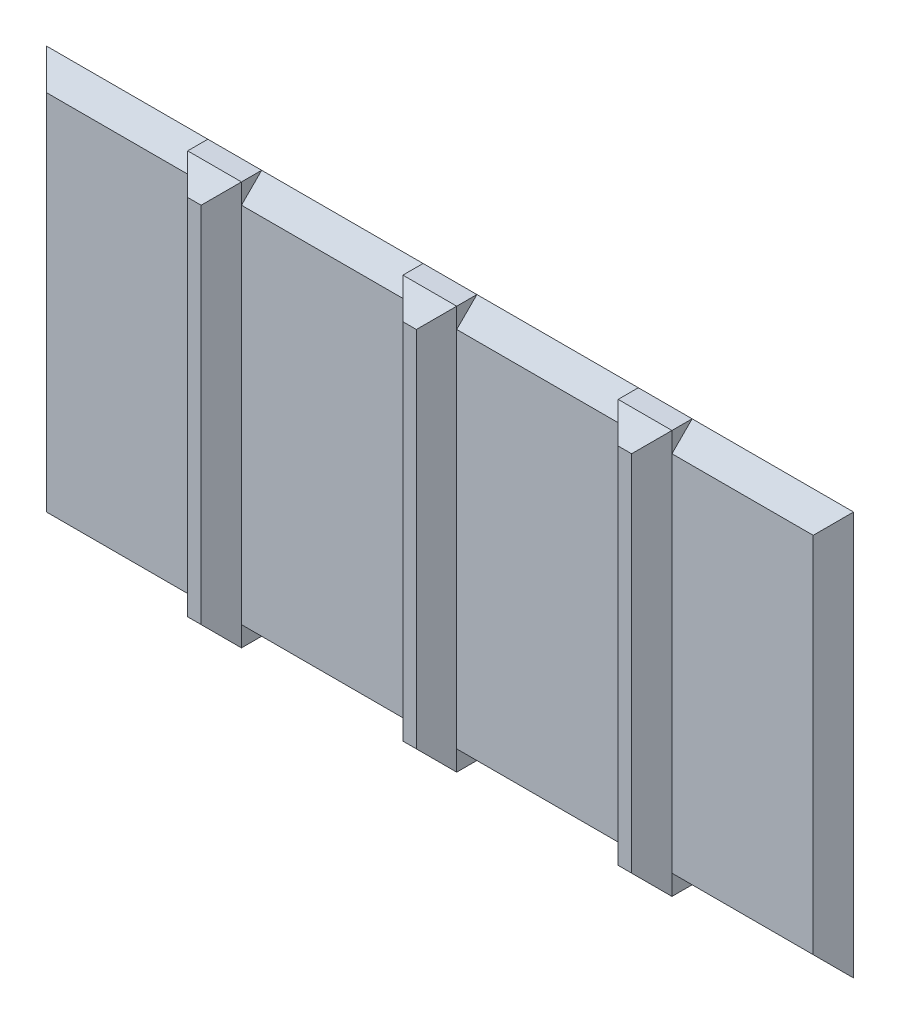
from build123d import *

# Parameters (mm, degrees)
SKETCH1_W           = 10.16
SKETCH1_H           = 5.08
BOSS_EXTRUDE1_DEPTH = 0.508
SKETCH2_W           = 0.6773418
SKETCH2_H           = 5.08
BOSS_EXTRUDE2_DEPTH = 0.254
CHAMFER3_SIZE       = 0.254
CHAMFER4_SIZE       = 0.254
CHAMFER5_SIZE       = 0.254


with BuildPart() as part:
    # Sketch1 → Boss-Extrude1 (new body)
    with BuildSketch(Plane.XY):
        with Locations((5.08, 2.54)):
            Rectangle(SKETCH1_W, SKETCH1_H)
    extrude(amount=BOSS_EXTRUDE1_DEPTH)

    # Sketch2 → Boss-Extrude2 (add)
    with BuildSketch(Plane.XY.offset(0.508)):
        with Locations((2.3706709, 2.54)):
            Rectangle(SKETCH2_W, SKETCH2_H)
        with Locations((5.0800127, 2.54)):
            Rectangle(SKETCH2_W, SKETCH2_H)
        with Locations((7.7893545, 2.54)):
            Rectangle(SKETCH2_W, SKETCH2_H)
    extrude(amount=BOSS_EXTRUDE2_DEPTH)

    # Chamfer3
    chamfer3_edges = [part.edges().sort_by_distance(p)[0] for p in [
        (5.08, 5.08, 0),
        (10.16, 2.54, 0),
        (5.08, 0, 0),
        (1.016, 0, 0.508),
        (3.7253418, 0, 0.508),
        (6.4346836, 0, 0.508),
        (9.1440127, 0, 0.508),
        (10.16, 2.54, 0.508),
        (9.1440127, 5.08, 0.508),
        (6.4346836, 5.08, 0.508),
        (3.7253418, 5.08, 0.508),
        (1.016, 5.08, 0.508),
    ]]
    chamfer(chamfer3_edges, length=CHAMFER3_SIZE - 0.0001)  # a hair under: the kernel refuses the full size

    # Chamfer4
    chamfer4_edges = [part.edges().sort_by_distance(p)[0] for p in [
        (0, 2.54, 0),
        (0, 2.54, 0.508),
    ]]
    chamfer(chamfer4_edges, length=CHAMFER4_SIZE - 0.0001)  # a hair under: the kernel refuses the full size

    # Chamfer5
    chamfer5_edges = [part.edges().sort_by_distance(p)[0] for p in [
        (2.3706709, 5.08, 0.762),
        (2.7093418, 2.54, 0.762),
        (2.032, 2.54, 0.762),
        (2.3706709, 0, 0.762),
        (5.4186836, 2.54, 0.762),
        (5.0800127, 5.08, 0.762),
        (4.7413418, 2.54, 0.762),
        (5.0800127, 0, 0.762),
        (8.1280254, 2.54, 0.762),
        (7.7893545, 5.08, 0.762),
        (7.4506836, 2.54, 0.762),
        (7.7893545, 0, 0.762),
    ]]
    chamfer(chamfer5_edges, length=CHAMFER5_SIZE - 0.0001)  # a hair under: the kernel refuses the full size


solid = part.part
